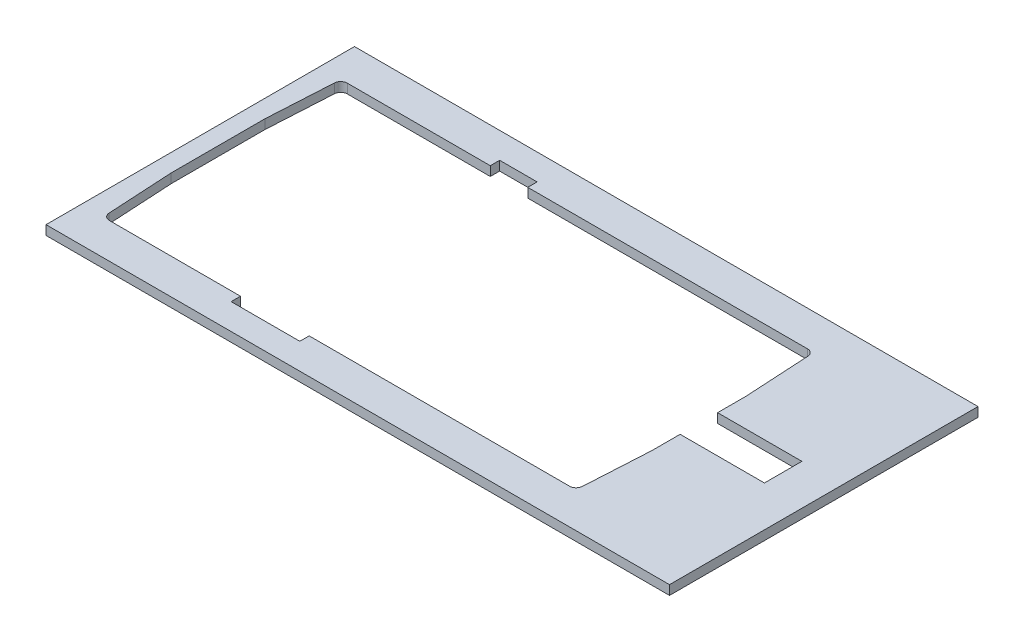
from build123d import *

# Parameters (mm, degrees)
SKETCH1_W           = 199.69
SKETCH1_H           = 98.8
BOSS_EXTRUDE1_DEPTH = 3


with BuildPart() as part:
    # Sketch1 → Boss-Extrude1 (new body)
    with BuildSketch(Plane(origin=(0, 0, 0), x_dir=(1, 0, 0), z_dir=(0, 1, 0))):
        with Locations((49.702694997, -22.272203273)):
            Rectangle(SKETCH1_W, SKETCH1_H)
        with BuildLine():
            Line((-41.155689707, 15.827796727), (4.647694997, 15.827796727))
            Line((4.647694997, 15.827796727), (4.647694997, 18.827796727))
            Line((4.647694997, 18.827796727), (16.647694997, 18.827796727))
            Line((16.647694997, 18.827796727), (16.647694997, 15.827796727))
            Line((16.647694997, 15.827796727), (106.2510797, 15.827796727))
            ThreePointArc((106.2510797, 15.827796727), (107.69325137, 15.254276625), (108.347694997, 13.846978515))
            Line((108.347694997, 13.846978515), (109.547694997, -7.263112363))
            Line((109.547694997, -7.263112363), (109.547694997, -16.272203273))
            Line((109.547694997, -16.272203273), (136.547694997, -16.272203273))
            Line((136.547694997, -16.272203273), (136.547694997, -28.272203273))
            Line((136.547694997, -28.272203273), (109.547694997, -28.272203273))
            Line((109.547694997, -28.272203273), (109.547694997, -37.281294182))
            Line((109.547694997, -37.281294182), (108.347694997, -58.39138506))
            ThreePointArc((108.347694997, -58.39138506), (107.69325137, -59.79868317), (106.2510797, -60.372203273))
            Line((106.2510797, -60.372203273), (22.847694997, -60.372203273))
            Line((22.847694997, -60.372203273), (22.847694997, -63.372203273))
            Line((22.847694997, -63.372203273), (0.847694997, -63.372203273))
            Line((0.847694997, -63.372203273), (0.847694997, -60.372203273))
            Line((0.847694997, -60.372203273), (-41.155689707, -60.372203273))
            ThreePointArc((-41.155689707, -60.372203273), (-42.597861376, -59.79868317), (-43.252305003, -58.39138506))
            Line((-43.252305003, -58.39138506), (-44.452305003, -37.281294182))
            Line((-44.452305003, -37.281294182), (-44.452305003, -7.263112363))
            Line((-44.452305003, -7.263112363), (-43.252305003, 13.846978515))
            ThreePointArc((-43.252305003, 13.846978515), (-42.597861376, 15.254276625), (-41.155689707, 15.827796727))
        make_face(mode=Mode.SUBTRACT)
    extrude(amount=BOSS_EXTRUDE1_DEPTH)


solid = part.part
